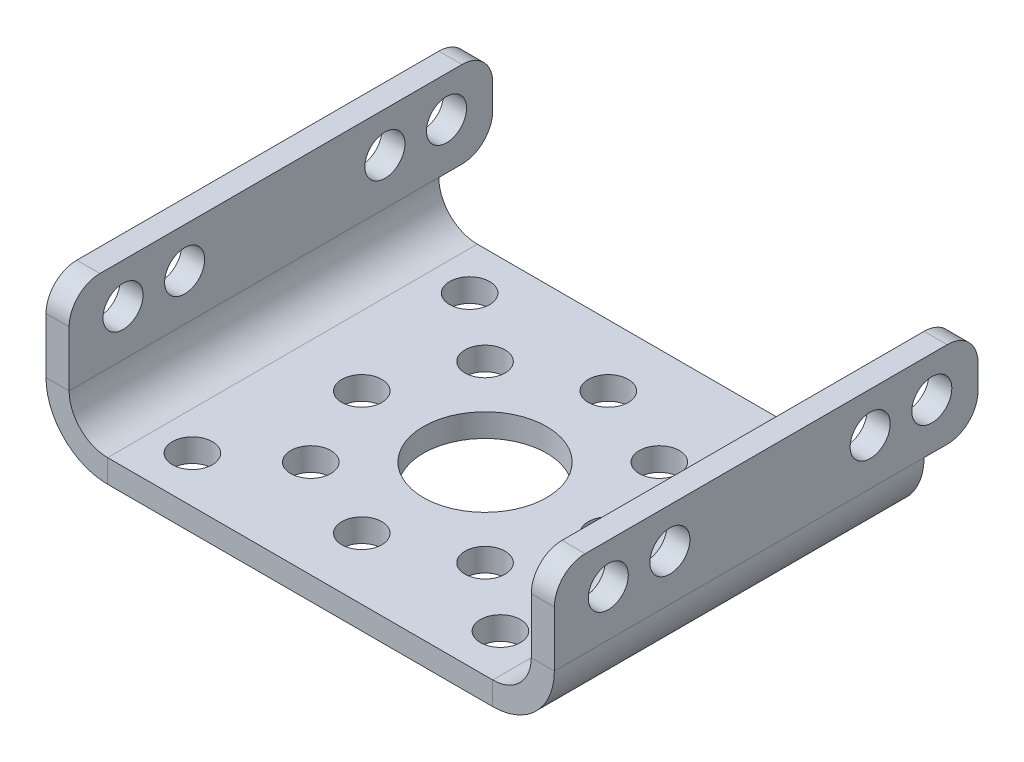
from build123d import *

# Parameters (mm, degrees)
BASE_FLANGE1_DEPTH      = 12
SKETCH5_R               = 4
SKETCH5_R_2             = 1.3
CUT_EXTRUDE1_DEPTH      = 10
SKETCH6_W               = 1.5
SKETCH6_H               = 5.6
BOSS_EXTRUDE1_DEPTH     = 3.5
CUT_EXTRUDE2_DEPTH      = 25.04391815
CUT_EXTRUDE2_DEPTH_BACK = 25.04391815
SKETCH7_R               = 1.3
FILLET1_R               = 2
SKETCH8_R               = 1.3
CUT_EXTRUDE3_DEPTH      = 10


# Sheet-metal steps are written as plain solids
with BuildPart() as part:
    # Sketch1 → Base-Flange1 (new, symmetric)
    with BuildSketch(Plane.XY):
        with BuildLine():
            Line((-15, 8.1), (-15, 2.5))
            ThreePointArc((-15, 2.5), (-14.267766953, 0.732233047), (-12.5, 0))
            Line((-12.5, 0), (12.5, 0))
            ThreePointArc((12.5, 0), (14.267766953, 0.732233047), (15, 2.5))
            Line((15, 2.5), (15, 8.1))
            Line((15, 8.1), (16.5, 8.1))
            Line((16.5, 8.1), (16.5, 2.5))
            ThreePointArc((16.5, 2.5), (15.328427125, -0.328427125), (12.5, -1.5))
            Line((12.5, -1.5), (-12.5, -1.5))
            ThreePointArc((-12.5, -1.5), (-15.328427125, -0.328427125), (-16.5, 2.5))
            Line((-16.5, 2.5), (-16.5, 8.1))
            Line((-16.5, 8.1), (-15, 8.1))
        make_face()
    extrude(amount=BASE_FLANGE1_DEPTH, both=True)

    # Sketch5 → Cut-Extrude1 (cut)
    with BuildSketch(Plane(origin=(0, 0, 0), x_dir=(1, 0, 0), z_dir=(0, 1, 0))):
        with Locations(Location((0, 0, 0), (0, 0, 180))):
            Circle(SKETCH5_R)
        with Locations(Location((0, 8, 0), (0, 0, 180))):
            Circle(SKETCH5_R_2)
        with Locations(Location((5.656854249, 5.656854249, 0), (0, 0, 180))):
            Circle(SKETCH5_R_2)
        with Locations(Location((8, 0, 0), (0, 0, 180))):
            Circle(SKETCH5_R_2)
        with Locations(Location((5.656854249, -5.656854249, 0), (0, 0, 180))):
            Circle(SKETCH5_R_2)
        with Locations(Location((0, -8, 0), (0, 0, 180))):
            Circle(SKETCH5_R_2)
        with Locations(Location((-5.656854249, -5.656854249, 0), (0, 0, 180))):
            Circle(SKETCH5_R_2)
        with Locations(Location((-8, 0, 0), (0, 0, 180))):
            Circle(SKETCH5_R_2)
        with Locations(Location((-5.656854249, 5.656854249, 0), (0, 0, 180))):
            Circle(SKETCH5_R_2)
    extrude(amount=-CUT_EXTRUDE1_DEPTH, mode=Mode.SUBTRACT)

    # Sketch6 → Boss-Extrude1 (add)
    with BuildSketch(Plane(origin=(0, 0, -12), x_dir=(-1, 0, 0), z_dir=(0, 0, -1))):
        with Locations((-15.75, 5.3)):
            Rectangle(SKETCH6_W, SKETCH6_H)
        with Locations((15.75, 5.3)):
            Rectangle(SKETCH6_W, SKETCH6_H)
    extrude(amount=BOSS_EXTRUDE1_DEPTH)

    # Sketch7 → Cut-Extrude2 (cut, two sides: drawn at the far end of the back side and taken through both)
    with BuildSketch(Plane(origin=(0, 0, 0), x_dir=(0, 0, -1), z_dir=(1, 0, 0)).offset(-CUT_EXTRUDE2_DEPTH_BACK)):
        with Locations((-8.5, 5.5)):
            Circle(SKETCH7_R)
        with Locations((-4.5, 5.5)):
            Circle(SKETCH7_R)
        with Locations((8.5, 5.5)):
            Circle(SKETCH7_R)
        with Locations((12.5, 5.5)):
            Circle(SKETCH7_R)
    extrude(amount=CUT_EXTRUDE2_DEPTH + CUT_EXTRUDE2_DEPTH_BACK, mode=Mode.SUBTRACT)

    # Fillet1
    fillet1_edges = [part.edges().sort_by_distance(p)[0] for p in [
        (15.75, 8.1, -15.5),
        (15.75, 2.5, -15.5),
        (-15.75, 8.1, -15.5),
        (-15.75, 2.5, -15.5),
        (-15.75, 8.1, 12),
        (15.75, 8.1, 12),
    ]]
    fillet(fillet1_edges, radius=FILLET1_R)

    # Sketch8 → Cut-Extrude3 (cut)
    with BuildSketch(Plane(origin=(0, 0, 0), x_dir=(1, 0, 0), z_dir=(0, 1, 0))):
        with Locations(Location((-10, 9, 0), (0, 0, 270))):
            Circle(SKETCH8_R)
        with Locations(Location((10, 9, 0), (0, 0, 270))):
            Circle(SKETCH8_R)
        with Locations(Location((-10, -9, 0), (0, 0, 270))):
            Circle(SKETCH8_R)
        with Locations(Location((10, -9, 0), (0, 0, 270))):
            Circle(SKETCH8_R)
    extrude(amount=-CUT_EXTRUDE3_DEPTH, mode=Mode.SUBTRACT)


solid = part.part
